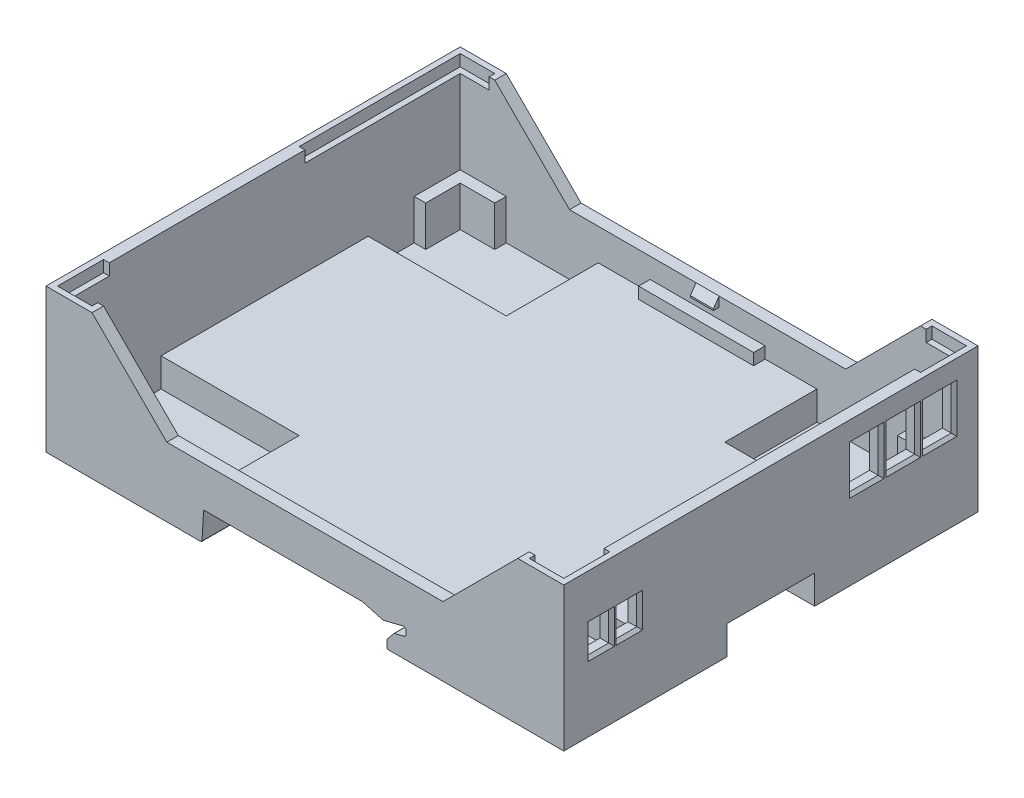
from build123d import *

# Parameters (mm, degrees)
SKETCH_1_W                  = 90
SKETCH_1_H                  = 72
EXTRUDE_1_DEPTH             = 25
CUT_EXTRUDE_1_DEPTH         = 72
FILLET_1_R                  = 0.5
FILLET_2_R                  = 0.2
CUT_EXTRUDE_2_DEPTH         = 28
FILLET_3_R                  = 0.5
SKETCH_9_W                  = 15.2
SKETCH_9_H                  = 5
CUT_EXTRUDE_4_DEPTH         = 36
SKETCH_10_W                 = 7.6
SKETCH_10_H                 = 5
CUT_EXTRUDE_5_DEPTH         = 4
CUT_EXTRUDE_6_DEPTH         = 72
SKETCH_12_W                 = 86
SKETCH_12_H                 = 68
CUT_EXTRUDE_7_DEPTH         = 18.5
SKETCH_13_W                 = 24
SKETCH_13_H                 = 16
CUT_EXTRUDE_8_DEPTH         = 5
MIRROR_4_COPY_1_SKETCH_W    = 24
MIRROR_4_COPY_1_SKETCH_H    = 16
MIRROR_4_COPY_1_DEPTH       = 5
MIRROR_4_COPY_2_SKETCH_W    = 24
MIRROR_4_COPY_2_SKETCH_H    = 16
MIRROR_4_COPY_2_DEPTH       = 5
EXTRUDE_4_DEPTH             = 7
MIRROR_6_COPY_1_DEPTH       = 7
MIRROR_6_COPY_2_DEPTH       = 7
SKETCH_15_W                 = 20
SKETCH_15_H                 = 2
EXTRUDE_5_DEPTH             = 2
SKETCH_17_W                 = 4
SKETCH_17_H                 = 1.7
EXTRUDE_6_DEPTH             = 1
CHAMFER_3_SIZE              = 1
CHAMFER_3_SIZE2             = 1.428148007
CHAMFER_3_OF_MIRROR_8_SIZE2 = 1.428148007
CHAMFER_3_OF_MIRROR_8_SIZE  = 1
SKETCH_22_W                 = 4
SKETCH_22_H                 = 2
CUT_EXTRUDE_9_DEPTH         = 2.6
CUT_EXTRUDE_15_DEPTH        = 2.4
CUT_EXTRUDE_17_DEPTH        = 6
CUT_EXTRUDE_18_DEPTH        = 2
MIRROR_11_COPY_1_DEPTH      = 2
MIRROR_11_COPY_2_DEPTH      = 2
SKETCH_26_W                 = 5
SKETCH_26_H                 = 7.5
SKETCH_26_W_2               = 3.6
SKETCH_26_H_2               = 5
CUT_EXTRUDE_19_DEPTH        = 2.5
CHAMFER_4_SIZE              = 0.5
SKETCH_27_W                 = 1
SKETCH_27_H                 = 20
CUT_EXTRUDE_20_DEPTH        = 2


with BuildPart() as part:
    # 草图1 → 凸台-拉伸1 (new body)
    with BuildSketch(Plane(origin=(0, 0, 0), x_dir=(1, 0, 0), z_dir=(0, 1, 0))):
        Rectangle(SKETCH_1_W, SKETCH_1_H)
    extrude(amount=EXTRUDE_1_DEPTH)

    # 草图4 → 切除-拉伸1 (cut)
    with BuildSketch(Plane.XY.offset(36)):
        Polygon((14.3, 0), (14.3, 1.5), (15.489963906, 2.965295015), (17.6, 3.5), (17.6, 5), (13.598917425, 4.003578801), (10, 5), (-17.6, 5), (-17.9, 0), align=None)
    extrude(amount=-CUT_EXTRUDE_1_DEPTH, mode=Mode.SUBTRACT)

    # 圆角1
    fillet_1_edges = [part.edges().sort_by_distance(p)[0] for p in [
        (17.6, 3.5, 0),
        (17.6, 5, 0),
    ]]
    fillet(fillet_1_edges, radius=FILLET_1_R)

    # 圆角2
    fillet_2_edges = [part.edges().sort_by_distance(p)[0] for p in [
        (-17.9, 0, 0),
        (-17.6, 5, 0),
        (15.489963906, 2.965295015, 0),
        (14.3, 1.5, 0),
        (14.3, 0, 0),
    ]]
    fillet(fillet_2_edges, radius=FILLET_2_R)

    # 草图5 → 切除-拉伸2 (cut)
    with BuildSketch(Plane.ZY.offset(45)):
        Polygon((5.6, 0), (5.6, 2.4), (7.6, 2.4), (7.6, 5), (-7.6, 5), (-7.6, 2.4), (-5.6, 2.4), (-5.6, 0), align=None)
    extrude(amount=-CUT_EXTRUDE_2_DEPTH, mode=Mode.SUBTRACT)

    # 圆角3
    fillet_3_edges = [part.edges().sort_by_distance(p)[0] for p in [
        (-31.205820162, 5, -7.6),
        (-31.205820162, 5, 7.6),
    ]]
    fillet(fillet_3_edges, radius=FILLET_3_R)

    # 草图9 → 切除-拉伸4 (cut)
    with BuildSketch(Plane(origin=(45, 0, 0), x_dir=(0, 0, -1), z_dir=(1, 0, 0))):
        with Locations((0, 2.5)):
            Rectangle(SKETCH_9_W, SKETCH_9_H)
    extrude(amount=-CUT_EXTRUDE_4_DEPTH, mode=Mode.SUBTRACT)

    # 草图10 → 切除-拉伸5 (cut)
    with BuildSketch(Plane(origin=(0, 0, 7.6), x_dir=(-1, 0, 0), z_dir=(0, 0, -1))):
        with Locations((-13.8, 2.5)):
            Rectangle(SKETCH_10_W, SKETCH_10_H)
    cut_extrude_5 = extrude(amount=-CUT_EXTRUDE_5_DEPTH, mode=Mode.SUBTRACT)

    # 镜向2: 切除-拉伸5 across plane
    add(cut_extrude_5.mirror(Plane(origin=(0, 0, 0), x_dir=(1, 0, 0), z_dir=(0, 0, -1))), mode=Mode.SUBTRACT)

    # 草图11 → 切除-拉伸6 (cut)
    with BuildSketch(Plane.XY.offset(36)):
        Polygon((-37, 25), (37, 25), (24, 12), (-24, 12), align=None)
    extrude(amount=-CUT_EXTRUDE_6_DEPTH, mode=Mode.SUBTRACT)

    # 草图12 → 切除-拉伸7 (cut)
    with BuildSketch(Plane(origin=(0, 25, 0), x_dir=(1, 0, 0), z_dir=(0, 1, 0))):
        Rectangle(SKETCH_12_W, SKETCH_12_H)
    extrude(amount=-CUT_EXTRUDE_7_DEPTH, mode=Mode.SUBTRACT)

    # 草图13 → 切除-拉伸8 (cut)
    with BuildSketch(Plane(origin=(0, 6.5, 0), x_dir=(1, 0, 0), z_dir=(0, 1, 0))):
        with Locations((31, -26)):
            Rectangle(SKETCH_13_W, SKETCH_13_H)
    cut_extrude_8 = extrude(amount=-CUT_EXTRUDE_8_DEPTH, mode=Mode.SUBTRACT)

    # 镜向3: 切除-拉伸8 across plane
    add(cut_extrude_8.mirror(Plane(origin=(0, 0, 0), x_dir=(1, 0, 0), z_dir=(0, 0, -1))), mode=Mode.SUBTRACT)

    # 镜向4 copy 1 sketch → 镜向4 copy 1 (cut)
    with BuildSketch(Plane(origin=(0, 6.5, 0), x_dir=(-1, 0, 0), z_dir=(0, 1, 0))):
        with Locations((31, -26)):
            Rectangle(MIRROR_4_COPY_1_SKETCH_W, MIRROR_4_COPY_1_SKETCH_H)
    extrude(amount=-MIRROR_4_COPY_1_DEPTH, mode=Mode.SUBTRACT)

    # 镜向4 copy 2 sketch → 镜向4 copy 2 (cut)
    with BuildSketch(Plane(origin=(0, 6.5, 0), x_dir=(-1, 0, 0), z_dir=(0, 1, 0))):
        with Locations((31, 26)):
            Rectangle(MIRROR_4_COPY_2_SKETCH_W, MIRROR_4_COPY_2_SKETCH_H)
    extrude(amount=-MIRROR_4_COPY_2_DEPTH, mode=Mode.SUBTRACT)

    # 草图14 → 凸台-拉伸4 (add)
    with BuildSketch(Plane(origin=(0, 1.5, 0), x_dir=(1, 0, 0), z_dir=(0, 1, 0))):
        Polygon((35, -34), (43, -34), (43, -26), (41, -26), (41, -32), (35, -32), align=None)
    extrude_4 = extrude(amount=EXTRUDE_4_DEPTH)

    # 镜向5: 凸台-拉伸4 across plane
    add(extrude_4.mirror(Plane(origin=(0, 0, 0), x_dir=(1, 0, 0), z_dir=(0, 0, -1))))

    # 镜向6 copy 1 sketch → 镜向6 copy 1 (add)
    with BuildSketch(Plane(origin=(0, 1.5, 0), x_dir=(-1, 0, 0), z_dir=(0, 1, 0))):
        Polygon((35, -34), (43, -34), (43, -26), (41, -26), (41, -32), (35, -32), align=None)
    extrude(amount=MIRROR_6_COPY_1_DEPTH)

    # 镜向6 copy 2 sketch → 镜向6 copy 2 (add)
    with BuildSketch(Plane(origin=(0, 1.5, 0), x_dir=(-1, 0, 0), z_dir=(0, 1, 0))):
        Polygon((35, 34), (43, 34), (43, 26), (41, 26), (41, 32), (35, 32), align=None)
    extrude(amount=MIRROR_6_COPY_2_DEPTH)

    # 草图15 → 凸台-拉伸5 (add)
    with BuildSketch(Plane(origin=(0, 6.5, 0), x_dir=(1, 0, 0), z_dir=(0, 1, 0))):
        with Locations((0, 33)):
            Rectangle(SKETCH_15_W, SKETCH_15_H)
    extrude_5 = extrude(amount=EXTRUDE_5_DEPTH)

    # 镜向7: 凸台-拉伸5 across plane
    add(extrude_5.mirror(Plane(origin=(0, 0, 0), x_dir=(1, 0, 0), z_dir=(0, 0, -1))))

    # 草图17 → 凸台-拉伸6 (add)
    with BuildSketch(Plane.XY.offset(-34)):
        with Locations((0, 11.15)):
            Rectangle(SKETCH_17_W, SKETCH_17_H)
    extrude_6 = extrude(amount=EXTRUDE_6_DEPTH)

    # 倒角3
    chamfer_3_edges = [part.edges().sort_by_distance(p)[0] for p in [
        (0, 12, -33),
    ]]
    chamfer_3_side = [part.faces().sort_by_distance(p)[0] for p in [
        (0, 12, -34.94),
    ]]
    chamfer(chamfer_3_edges, length=CHAMFER_3_SIZE, length2=CHAMFER_3_SIZE2, reference=chamfer_3_side[0])

    # 镜向8: 凸台-拉伸6 across plane
    add(extrude_6.mirror(Plane(origin=(0, 0, 0), x_dir=(1, 0, 0), z_dir=(0, 0, -1))))

    # 倒角3 of 镜向8
    chamfer_3_of_mirror_8_edges = [part.edges().sort_by_distance(p)[0] for p in [
        (0, 12, 33),
    ]]
    chamfer(chamfer_3_of_mirror_8_edges, length=CHAMFER_3_OF_MIRROR_8_SIZE, length2=CHAMFER_3_OF_MIRROR_8_SIZE2)

    # 草图22 → 切除-拉伸9 (cut)
    with BuildSketch(Plane.XZ):
        with Locations((-19.756, 6.6)):
            Rectangle(SKETCH_22_W, SKETCH_22_H)
    cut_extrude_9 = extrude(amount=-CUT_EXTRUDE_9_DEPTH, mode=Mode.SUBTRACT)

    # 镜向9: 切除-拉伸9 across plane
    add(cut_extrude_9.mirror(Plane.XY), mode=Mode.SUBTRACT)

    # 草图23 → 切除-拉伸15 (cut)
    with BuildSketch(Plane(origin=(0, 5, 0), x_dir=(1, 0, 0), z_dir=(0, 1, 0))):
        Polygon((-31.2, 7.6), (-28.2, 7.6), (-29.2, 8.6), (-30.2, 8.6), align=None)
        Polygon((-28, 7.6), (-27, 8.6), (-26, 8.6), (-25, 7.6), align=None)
    cut_extrude_15 = extrude(amount=-CUT_EXTRUDE_15_DEPTH, mode=Mode.SUBTRACT)

    # 草图24 → 切除-拉伸17 (cut)
    with BuildSketch(Plane.XY.offset(3)):
        Polygon((-45, 5), (-45, 7.598076211), (-43.5, 5), align=None)
    extrude(amount=-CUT_EXTRUDE_17_DEPTH, mode=Mode.SUBTRACT)

    # 草图25 → 切除-拉伸18 (cut)
    with BuildSketch(Plane(origin=(0, 25, 0), x_dir=(1, 0, 0), z_dir=(0, 1, 0))):
        Polygon((44, 27), (43, 27), (43, 34), (38, 34), (38, 35), (44, 35), align=None)
    cut_extrude_18 = extrude(amount=-CUT_EXTRUDE_18_DEPTH, mode=Mode.SUBTRACT)

    # 镜向10: 切除-拉伸18 across plane
    add(cut_extrude_18.mirror(Plane.XY), mode=Mode.SUBTRACT)

    # 镜向11 copy 1 sketch → 镜向11 copy 1 (cut)
    with BuildSketch(Plane(origin=(0, 25, 0), x_dir=(-1, 0, 0), z_dir=(0, 1, 0))):
        Polygon((44, 27), (43, 27), (43, 34), (38, 34), (38, 35), (44, 35), align=None)
    extrude(amount=-MIRROR_11_COPY_1_DEPTH, mode=Mode.SUBTRACT)

    # 镜向11 copy 2 sketch → 镜向11 copy 2 (cut)
    with BuildSketch(Plane(origin=(0, 25, 0), x_dir=(-1, 0, 0), z_dir=(0, 1, 0))):
        Polygon((44, -27), (43, -27), (43, -34), (38, -34), (38, -35), (44, -35), align=None)
    extrude(amount=-MIRROR_11_COPY_2_DEPTH, mode=Mode.SUBTRACT)

    # 草图26 → 切除-拉伸19 (cut)
    with BuildSketch(Plane(origin=(45, 0, 0), x_dir=(0, 0, -1), z_dir=(1, 0, 0))):
        with Locations((29.34, 17.45)):
            Rectangle(SKETCH_26_W, SKETCH_26_H)
        with Locations((22.99, 17.45)):
            Rectangle(SKETCH_26_W, SKETCH_26_H)
        with Locations((16.64, 17.45)):
            Rectangle(SKETCH_26_W, SKETCH_26_H)
        with Locations((-29.5, 14.37)):
            Rectangle(SKETCH_26_W_2, SKETCH_26_H_2)
        with Locations((-24.62, 14.37)):
            Rectangle(SKETCH_26_W_2, SKETCH_26_H_2)
    extrude(amount=-CUT_EXTRUDE_19_DEPTH, mode=Mode.SUBTRACT)

    # 倒角4
    chamfer_4_edges = [part.edges().sort_by_distance(p)[0] for p in [
        (45, 17.45, -26.84),
        (45, 13.7, -29.34),
        (45, 17.45, -31.84),
        (45, 21.2, -29.34),
        (45, 21.2, -22.99),
        (45, 17.45, -20.49),
        (45, 13.7, -22.99),
        (45, 17.45, -25.49),
        (45, 21.2, -16.64),
        (45, 17.45, -19.14),
        (45, 13.7, -16.64),
        (45, 17.45, -14.14),
        (45, 14.37, 31.3),
        (45, 11.87, 29.5),
        (45, 16.87, 29.5),
        (45, 14.37, 27.7),
        (45, 14.37, 26.42),
        (45, 11.87, 24.62),
        (45, 16.87, 24.62),
        (45, 14.37, 22.82),
    ]]
    chamfer(chamfer_4_edges, length=CHAMFER_4_SIZE)

    # 镜向12: 切除-拉伸15 across plane
    add(cut_extrude_15.mirror(Plane(origin=(0, 0, 0), x_dir=(1, 0, 0), z_dir=(0, 0, -1))), mode=Mode.SUBTRACT)

    # 草图27 → 切除-拉伸20 (cut)
    with BuildSketch(Plane(origin=(0, 25, 0), x_dir=(1, 0, 0), z_dir=(0, 1, 0))):
        with Locations((-43.5, 17)):
            Rectangle(SKETCH_27_W, SKETCH_27_H)
    extrude(amount=-CUT_EXTRUDE_20_DEPTH, mode=Mode.SUBTRACT)


solid = part.part
